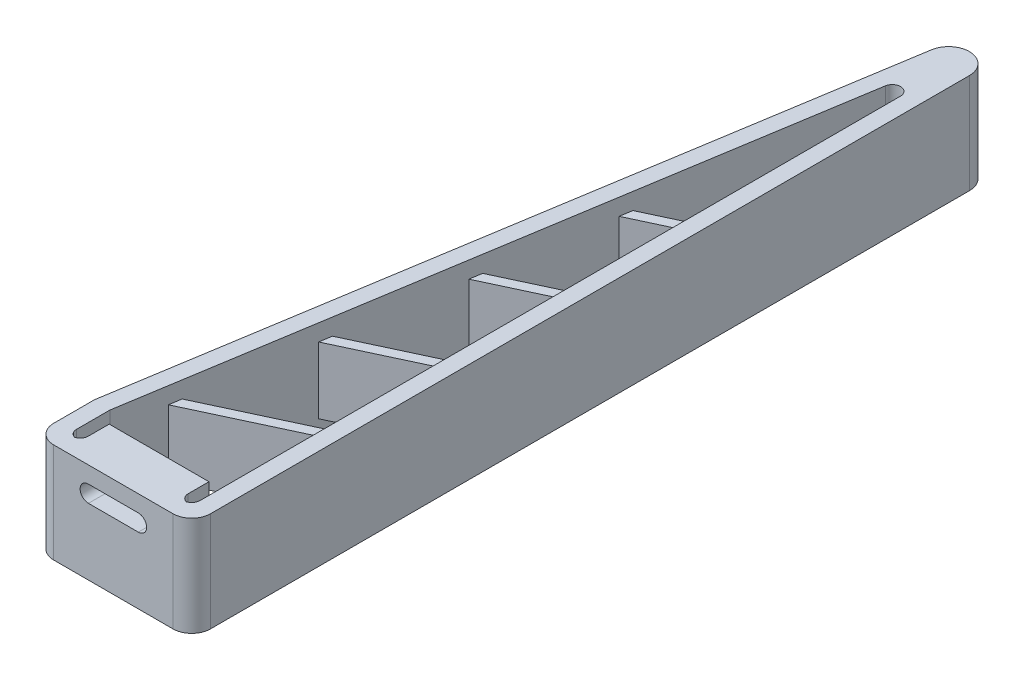
from build123d import *

# Parameters (mm, degrees)
BOSS_EXTRUDE1_DEPTH     = 6
BOSS_EXTRUDE2_DEPTH     = 4
SKETCH6_R               = 0.5
CUT_EXTRUDE1_DEPTH      = 1
FILL_START              = -19.748812638
FILL_PATTERN1_OUTLINE_R = 0.5
FILL_PATTERN1_DEPTH     = 1
FILLET1_R               = 2.25
FILLET2_R               = 1
CUT_EXTRUDE2_DEPTH      = 10


# Read off the part's stored shape, not the designer's step: Fill Pattern1
with BuildPart() as part:
    # Sketch1 → Boss-Extrude1 (new, symmetric)
    with BuildSketch(Plane(origin=(0, 0, 0), x_dir=(1, 0, 0), z_dir=(0, 1, 0))):
        with BuildLine():
            Line((0, 93.551263874), (0, 0))
            Line((0, 0), (-18.854561776, 0))
            Line((-18.854561776, 0), (-18.854561776, 7.158988901))
            Line((-18.854561776, 7.158988901), (-4.96860158, 93.946240126))
            ThreePointArc((-4.96860158, 93.946240126), (-2.301888856, 96.043401906), (0, 93.551263874))
        make_face()
        with BuildLine():
            Line((-16.854561776, 7), (-3.987440632, 87.419507149))
            ThreePointArc((-3.987440632, 87.419507149), (-2.920755543, 88.258371861), (-2, 87.261516648))
            Line((-2, 87.261516648), (-2, 2))
            Line((-2, 2), (-3.427280888, 2))
            Line((-3.427280888, 2), (-3.427280888, 5.5))
            Line((-3.427280888, 5.5), (-15.427280888, 5.5))
            Line((-15.427280888, 5.5), (-15.427280888, 2))
            Line((-15.427280888, 2), (-16.854561776, 2))
            Line((-16.854561776, 2), (-16.854561776, 7))
        make_face(mode=Mode.SUBTRACT)
    extrude(amount=BOSS_EXTRUDE1_DEPTH, both=True)

    # Sketch3 → Boss-Extrude2 (add, symmetric)
    with BuildSketch(Plane(origin=(0, 0, 0), x_dir=(1, 0, 0), z_dir=(0, 1, 0))):
        Polygon((-10.896641885, 44.236999319), (-2, 48.385571562), (-2, 49.709625065), (-10.667713127, 45.667804055), align=None)
        Polygon((-2, 64.128372472), (-8.174712712, 61.249056647), (-8.40364147, 59.818251912), (-2, 62.804318969), align=None)
        Polygon((-2, 35.29441296), (-13.160102288, 30.090371797), (-13.3896423, 28.655746726), (-2, 33.966824154), align=None)
        Polygon((-2, 20.87213025), (-15.653713957, 14.505298869), (-15.882642714, 13.074494134), (-2, 19.548076747), align=None)
    extrude(amount=BOSS_EXTRUDE2_DEPTH, both=True)

    # Sketch6 → Cut-Extrude1 (cut)
    with BuildSketch(Plane(origin=(-19.500780031, 0, -3.120124805), x_dir=(-0.15799050110667284, 0, 0.9874406319167055), z_dir=(-0.9874406319167055, 0, -0.15799050110667284))):
        with Locations((-47.590234861, 0)):
            Circle(SKETCH6_R)
    extrude(amount=-CUT_EXTRUDE1_DEPTH, mode=Mode.SUBTRACT)

    # Fill Pattern1 outline → Fill Pattern1 (cut)
    with BuildSketch(Plane(origin=(0, 0, 0), x_dir=(0, 1, 0), z_dir=(0.9874406319167054, 0, 0.1579905011066731)).offset(FILL_START)):
        with Locations((3, -44.590234861)):
            Circle(FILL_PATTERN1_OUTLINE_R)
        with Locations((3, -83.590234861)):
            Circle(FILL_PATTERN1_OUTLINE_R)
        with Locations((3, -8.590234861)):
            Circle(FILL_PATTERN1_OUTLINE_R)
        with Locations((0, -8.590234861)):
            Circle(FILL_PATTERN1_OUTLINE_R)
        with Locations((-3, -8.590234861)):
            Circle(FILL_PATTERN1_OUTLINE_R)
        with Locations((-3, -86.590234861)):
            Circle(FILL_PATTERN1_OUTLINE_R)
        with Locations((0, -86.590234861)):
            Circle(FILL_PATTERN1_OUTLINE_R)
        with Locations((3, -86.590234861)):
            Circle(FILL_PATTERN1_OUTLINE_R)
        with Locations((3, -5.590234861)):
            Circle(FILL_PATTERN1_OUTLINE_R)
        with Locations((-3, -80.590234861)):
            Circle(FILL_PATTERN1_OUTLINE_R)
        with Locations((0, -80.590234861)):
            Circle(FILL_PATTERN1_OUTLINE_R)
        with Locations((3, -80.590234861)):
            Circle(FILL_PATTERN1_OUTLINE_R)
        with Locations((3, -11.590234861)):
            Circle(FILL_PATTERN1_OUTLINE_R)
        with Locations((0, -11.590234861)):
            Circle(FILL_PATTERN1_OUTLINE_R)
        with Locations((-3, -11.590234861)):
            Circle(FILL_PATTERN1_OUTLINE_R)
        with Locations((-3, -83.590234861)):
            Circle(FILL_PATTERN1_OUTLINE_R)
        with Locations((0, -83.590234861)):
            Circle(FILL_PATTERN1_OUTLINE_R)
        with Locations((0, -5.590234861)):
            Circle(FILL_PATTERN1_OUTLINE_R)
        with Locations((-3, -5.590234861)):
            Circle(FILL_PATTERN1_OUTLINE_R)
        with Locations((-3, -89.590234861)):
            Circle(FILL_PATTERN1_OUTLINE_R)
        with Locations((0, -89.590234861)):
            Circle(FILL_PATTERN1_OUTLINE_R)
        with Locations((3, -89.590234861)):
            Circle(FILL_PATTERN1_OUTLINE_R)
        with Locations((0, -59.590234861)):
            Circle(FILL_PATTERN1_OUTLINE_R)
        with Locations((-3, -59.590234861)):
            Circle(FILL_PATTERN1_OUTLINE_R)
        with Locations((-3, -35.590234861)):
            Circle(FILL_PATTERN1_OUTLINE_R)
        with Locations((0, -35.590234861)):
            Circle(FILL_PATTERN1_OUTLINE_R)
        with Locations((3, -35.590234861)):
            Circle(FILL_PATTERN1_OUTLINE_R)
        with Locations((3, -56.590234861)):
            Circle(FILL_PATTERN1_OUTLINE_R)
        with Locations((0, -56.590234861)):
            Circle(FILL_PATTERN1_OUTLINE_R)
        with Locations((-3, -56.590234861)):
            Circle(FILL_PATTERN1_OUTLINE_R)
        with Locations((3, -29.590234861)):
            Circle(FILL_PATTERN1_OUTLINE_R)
        with Locations((3, -62.590234861)):
            Circle(FILL_PATTERN1_OUTLINE_R)
        with Locations((0, -62.590234861)):
            Circle(FILL_PATTERN1_OUTLINE_R)
        with Locations((-3, -62.590234861)):
            Circle(FILL_PATTERN1_OUTLINE_R)
        with Locations((-3, -32.590234861)):
            Circle(FILL_PATTERN1_OUTLINE_R)
        with Locations((0, -32.590234861)):
            Circle(FILL_PATTERN1_OUTLINE_R)
        with Locations((3, -32.590234861)):
            Circle(FILL_PATTERN1_OUTLINE_R)
        with Locations((3, -59.590234861)):
            Circle(FILL_PATTERN1_OUTLINE_R)
        with Locations((3, -41.590234861)):
            Circle(FILL_PATTERN1_OUTLINE_R)
        with Locations((3, -47.590234861)):
            Circle(FILL_PATTERN1_OUTLINE_R)
        with Locations((3, -50.590234861)):
            Circle(FILL_PATTERN1_OUTLINE_R)
        with Locations((0, -50.590234861)):
            Circle(FILL_PATTERN1_OUTLINE_R)
        with Locations((-3, -50.590234861)):
            Circle(FILL_PATTERN1_OUTLINE_R)
        with Locations((-3, -47.590234861)):
            Circle(FILL_PATTERN1_OUTLINE_R)
        with Locations((-3, -44.590234861)):
            Circle(FILL_PATTERN1_OUTLINE_R)
        with Locations((0, -44.590234861)):
            Circle(FILL_PATTERN1_OUTLINE_R)
        with Locations((-3, -38.590234861)):
            Circle(FILL_PATTERN1_OUTLINE_R)
        with Locations((0, -38.590234861)):
            Circle(FILL_PATTERN1_OUTLINE_R)
        with Locations((3, -38.590234861)):
            Circle(FILL_PATTERN1_OUTLINE_R)
        with Locations((3, -53.590234861)):
            Circle(FILL_PATTERN1_OUTLINE_R)
        with Locations((0, -53.590234861)):
            Circle(FILL_PATTERN1_OUTLINE_R)
        with Locations((-3, -53.590234861)):
            Circle(FILL_PATTERN1_OUTLINE_R)
        with Locations((-3, -41.590234861)):
            Circle(FILL_PATTERN1_OUTLINE_R)
        with Locations((0, -41.590234861)):
            Circle(FILL_PATTERN1_OUTLINE_R)
        with Locations((3, -17.590234861)):
            Circle(FILL_PATTERN1_OUTLINE_R)
        with Locations((3, -74.590234861)):
            Circle(FILL_PATTERN1_OUTLINE_R)
        with Locations((0, -74.590234861)):
            Circle(FILL_PATTERN1_OUTLINE_R)
        with Locations((-3, -74.590234861)):
            Circle(FILL_PATTERN1_OUTLINE_R)
        with Locations((-3, -20.590234861)):
            Circle(FILL_PATTERN1_OUTLINE_R)
        with Locations((0, -20.590234861)):
            Circle(FILL_PATTERN1_OUTLINE_R)
        with Locations((3, -20.590234861)):
            Circle(FILL_PATTERN1_OUTLINE_R)
        with Locations((3, -71.590234861)):
            Circle(FILL_PATTERN1_OUTLINE_R)
        with Locations((-3, -14.590234861)):
            Circle(FILL_PATTERN1_OUTLINE_R)
        with Locations((0, -14.590234861)):
            Circle(FILL_PATTERN1_OUTLINE_R)
        with Locations((3, -14.590234861)):
            Circle(FILL_PATTERN1_OUTLINE_R)
        with Locations((3, -77.590234861)):
            Circle(FILL_PATTERN1_OUTLINE_R)
        with Locations((0, -77.590234861)):
            Circle(FILL_PATTERN1_OUTLINE_R)
        with Locations((-3, -77.590234861)):
            Circle(FILL_PATTERN1_OUTLINE_R)
        with Locations((-3, -17.590234861)):
            Circle(FILL_PATTERN1_OUTLINE_R)
        with Locations((0, -17.590234861)):
            Circle(FILL_PATTERN1_OUTLINE_R)
        with Locations((-3, -26.590234861)):
            Circle(FILL_PATTERN1_OUTLINE_R)
        with Locations((0, -26.590234861)):
            Circle(FILL_PATTERN1_OUTLINE_R)
        with Locations((3, -26.590234861)):
            Circle(FILL_PATTERN1_OUTLINE_R)
        with Locations((3, -65.590234861)):
            Circle(FILL_PATTERN1_OUTLINE_R)
        with Locations((0, -65.590234861)):
            Circle(FILL_PATTERN1_OUTLINE_R)
        with Locations((-3, -65.590234861)):
            Circle(FILL_PATTERN1_OUTLINE_R)
        with Locations((-3, -29.590234861)):
            Circle(FILL_PATTERN1_OUTLINE_R)
        with Locations((0, -29.590234861)):
            Circle(FILL_PATTERN1_OUTLINE_R)
        with Locations((0, -71.590234861)):
            Circle(FILL_PATTERN1_OUTLINE_R)
        with Locations((-3, -71.590234861)):
            Circle(FILL_PATTERN1_OUTLINE_R)
        with Locations((-3, -23.590234861)):
            Circle(FILL_PATTERN1_OUTLINE_R)
        with Locations((0, -23.590234861)):
            Circle(FILL_PATTERN1_OUTLINE_R)
        with Locations((3, -23.590234861)):
            Circle(FILL_PATTERN1_OUTLINE_R)
        with Locations((3, -68.590234861)):
            Circle(FILL_PATTERN1_OUTLINE_R)
        with Locations((0, -68.590234861)):
            Circle(FILL_PATTERN1_OUTLINE_R)
        with Locations((-3, -68.590234861)):
            Circle(FILL_PATTERN1_OUTLINE_R)
    extrude(amount=FILL_PATTERN1_DEPTH, mode=Mode.SUBTRACT)

    # Fillet1
    fillet1_edges = [part.edges().sort_by_distance(p)[0] for p in [
        (-18.854561776, 0, 0),
        (-18.854561776, 0, -7.158988901),
        (0, 0, 0),
    ]]
    fillet(fillet1_edges, radius=FILLET1_R)

    # Fillet2
    # the kernel refuses this fillet: 1 mm, written as the material it adds along each edge
    with BuildSketch(Plane(origin=(-3.427280888, 6, -2), x_dir=(0, 0, -1), z_dir=(0, -1, 0)), Plane(origin=(-2, 6, -2), x_dir=(-1, 0, 0), z_dir=(0, -1, 0)), Plane(origin=(-15.427280888, 6, -2), x_dir=(-1, 0, 0), z_dir=(0, -1, 0)), Plane(origin=(-16.854561776, 6, -2), x_dir=(0, 0, -1), z_dir=(0, -1, 0))) as fillet2_piece_1:
        with BuildLine():
            CenterArc((FILLET2_R, FILLET2_R), FILLET2_R, 180, 90)
            Line((0, FILLET2_R), (0, 0))
            Line((0, 0), (FILLET2_R, 0))
        make_face()
    extrude(amount=12)

    # Sketch7 → Cut-Extrude2 (cut)
    with BuildSketch(Plane(origin=(0, 0, -5.5), x_dir=(-1, 0, 0), z_dir=(0, 0, -1))):
        with BuildLine():
            Line((12.427280888, 4), (6.427280888, 4))
            ThreePointArc((6.427280888, 4), (5.427280888, 3), (6.427280888, 2))
            Line((6.427280888, 2), (12.427280888, 2))
            ThreePointArc((12.427280888, 2), (13.427280888, 3), (12.427280888, 4))
        make_face()
    extrude(amount=-CUT_EXTRUDE2_DEPTH, mode=Mode.SUBTRACT)


solid = part.part
